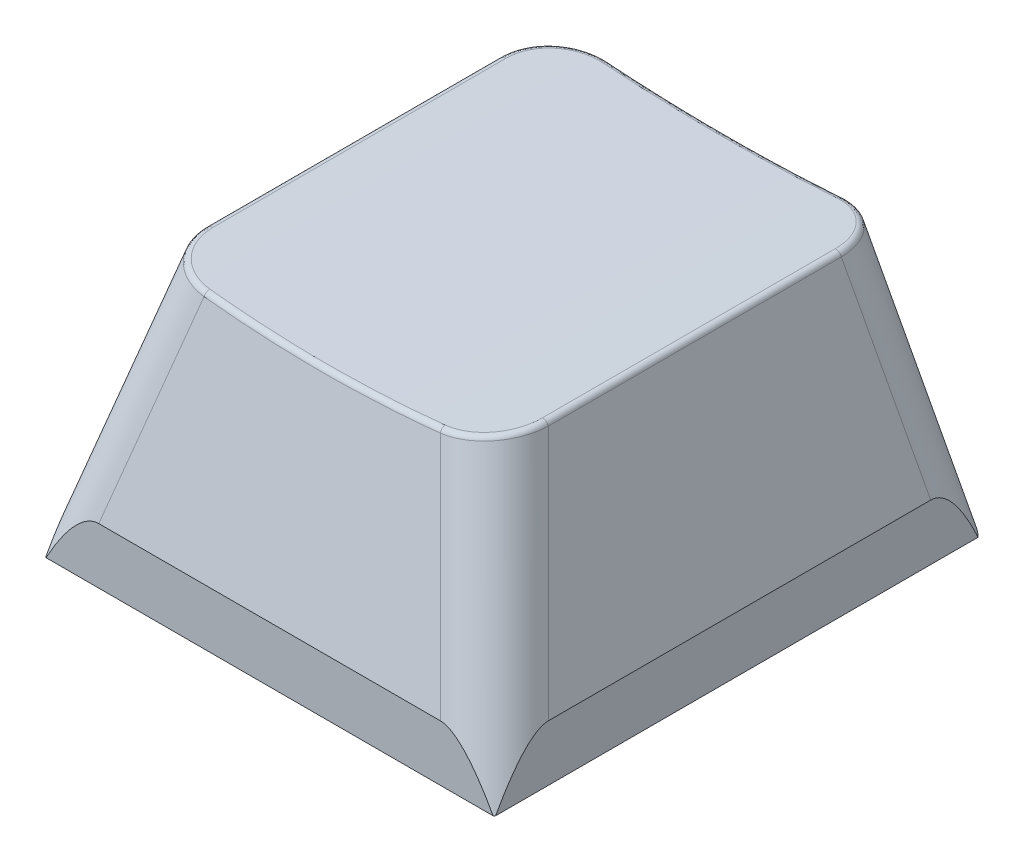
from build123d import *

# Parameters (mm, degrees)
SKETCH1_W                = 11.8
SKETCH1_H                = 14
BOSS_EXTRUDE1_DEPTH      = 8
DRAFT1_ANGLE             = 15
DRAFT2_ANGLE             = 10
SKETCH2_W                = 16.087187078
SKETCH2_H                = 17.554209385
BOSS_EXTRUDE2_DEPTH      = 2
SURFACE_EXTRUDE1_1_BACK  = 58
SURFACE_EXTRUDE1_1_DEPTH = 113
FILLET1_R                = 2
FILLET2_R                = 0.2
SHELL1_T                 = -1


with BuildPart() as part:
    # Sketch1 → Boss-Extrude1 (new body)
    with BuildSketch(Plane(origin=(0, 0, 0), x_dir=(1, 0, 0), z_dir=(0, 1, 0))):
        with Locations((5.9, 7)):
            Rectangle(SKETCH1_W, SKETCH1_H)
    extrude(amount=BOSS_EXTRUDE1_DEPTH)

    # Draft1
    draft1_faces = [part.faces().sort_by_distance(p)[0] for p in [
        (0, 4, -7),
        (11.8, 4, -7),
        (5.9, 4, 0),
    ]]
    draft(draft1_faces, Plane.ZX.offset(8), DRAFT1_ANGLE)

    # Draft2
    draft2_faces = [part.faces().sort_by_distance(p)[0] for p in [
        (5.9, 3.795022373, -14),
    ]]
    draft(draft2_faces, Plane.ZX.offset(8), DRAFT2_ANGLE)

    # Sketch2 → Boss-Extrude2 (add)
    with BuildSketch(Plane.XZ):
        with Locations((5.9, -6.633511154)):
            Rectangle(SKETCH2_W, SKETCH2_H)
    extrude(amount=BOSS_EXTRUDE2_DEPTH)

    # SurfaceCut1: cut with a surface, the side behind it stays
    # Surface-Extrude1: a surface, the sketch's curves swept straight by 113 mm
    with BuildLine(Plane.XY.offset(-SURFACE_EXTRUDE1_1_BACK), mode=Mode.PRIVATE) as surface_extrude1_1_path:
        ThreePointArc((-21.086355673, 14.907998295), (19.457651591, 8.87318748), (50.889640036, 35.18412758))
    surface_extrude1_1 = Shell.extrude(surface_extrude1_1_path.wire(), (0 * SURFACE_EXTRUDE1_1_DEPTH, 0 * SURFACE_EXTRUDE1_1_DEPTH, 1 * SURFACE_EXTRUDE1_1_DEPTH))
    split(bisect_by=surface_extrude1_1, keep=Keep.BOTTOM)

    # Fillet1
    # the kernel refuses this fillet: 2 mm, written as the material it takes off along each edge
    with BuildSketch(Plane(origin=(15.163214567, -4.551687642, -16.213201185), x_dir=(0.043455955252402, -0.1621798328934037, 0.9858038759082706), z_dir=(-0.25514481782094306, 0.9522134233956622, 0.16790091793742856))) as fillet1_piece_1:
        with BuildLine():
            CenterArc((FILLET1_R * 0.956022574328, -FILLET1_R), FILLET1_R, 90, 87.424061989)
            Line((-FILLET1_R * 0.0429669580526, -FILLET1_R * 0.955056544472), (0, 0))
            Line((0, 0), (FILLET1_R * 0.956022574328, 0))
        make_face()
    extrude(amount=17.299752545, mode=Mode.SUBTRACT)
    with BuildSketch(Plane(origin=(-3.363214567, -4.551687642, -16.213201185), x_dir=(-0.043455955252402, -0.1621798328934037, 0.9858038759082706), z_dir=(0.25514481782094306, 0.9522134233956622, 0.16790091793742856))) as fillet1_piece_2:
        with BuildLine():
            CenterArc((FILLET1_R * 0.956022574328, FILLET1_R), FILLET1_R, 182.575938011, 87.424061989)
            Line((-FILLET1_R * 0.0429669580526, FILLET1_R * 0.955056544472), (0, 0))
            Line((0, 0), (FILLET1_R * 0.956022574328, 0))
        make_face()
    extrude(amount=17.299752545, mode=Mode.SUBTRACT)
    with BuildSketch(Plane(origin=(15.115116389, -4.372182797, 3.315116389), x_dir=(-0.9681003458863746, -0.24202508647159424, 0.06485042646813635), z_dir=(-0.25056280708573214, 0.9351131265310292, -0.25056280708573214))) as fillet1_piece_3:
        with BuildLine():
            CenterArc((FILLET1_R * 0.935113126531, -FILLET1_R), FILLET1_R, 90, 86.159034284)
            Line((-FILLET1_R * 0.0626407017714, -FILLET1_R * 0.933012701892), (0, 0))
            Line((0, 0), (FILLET1_R * 0.935113126531, 0))
        make_face()
    extrude(amount=17.232189827, mode=Mode.SUBTRACT)
    with BuildSketch(Plane(origin=(-3.315116389, -4.372182797, 3.315116389), x_dir=(0.9681003458863746, -0.24202508647159424, 0.06485042646813623), z_dir=(0.25056280708573214, 0.9351131265310292, -0.25056280708573214))) as fillet1_piece_4:
        with BuildLine():
            CenterArc((FILLET1_R * 0.935113126531, FILLET1_R), FILLET1_R, 183.840965716, 86.159034284)
            Line((-FILLET1_R * 0.0626407017714, FILLET1_R * 0.933012701892), (0, 0))
            Line((0, 0), (FILLET1_R * 0.935113126531, 0))
        make_face()
    extrude(amount=17.232189827, mode=Mode.SUBTRACT)

    # Fillet2
    fillet2_edges = [part.edges().sort_by_distance(p)[0] for p in [
        (5.9, 7, -14.176326981),
        (11.968893383, 7.369681312, -6.967260399),
        (-0.168893383, 7.369681312, -6.967260399),
        (5.9, 7, 0.267949192),
        (0.365237708, 7.307280147, -0.379990942),
        (11.434762292, 7.307280147, -0.379990942),
        (0.387030173, 7.304857746, -13.559057745),
        (11.41296972, 7.304857733, -13.559057832),
    ]]
    fillet(fillet2_edges, radius=FILLET2_R)

    # Shell1
    shell1_openings = [part.faces().sort_by_distance(p)[0] for p in [
        (5.9, -2, -6.631481847),
    ]]
    offset(amount=SHELL1_T, openings=shell1_openings)


solid = part.part
